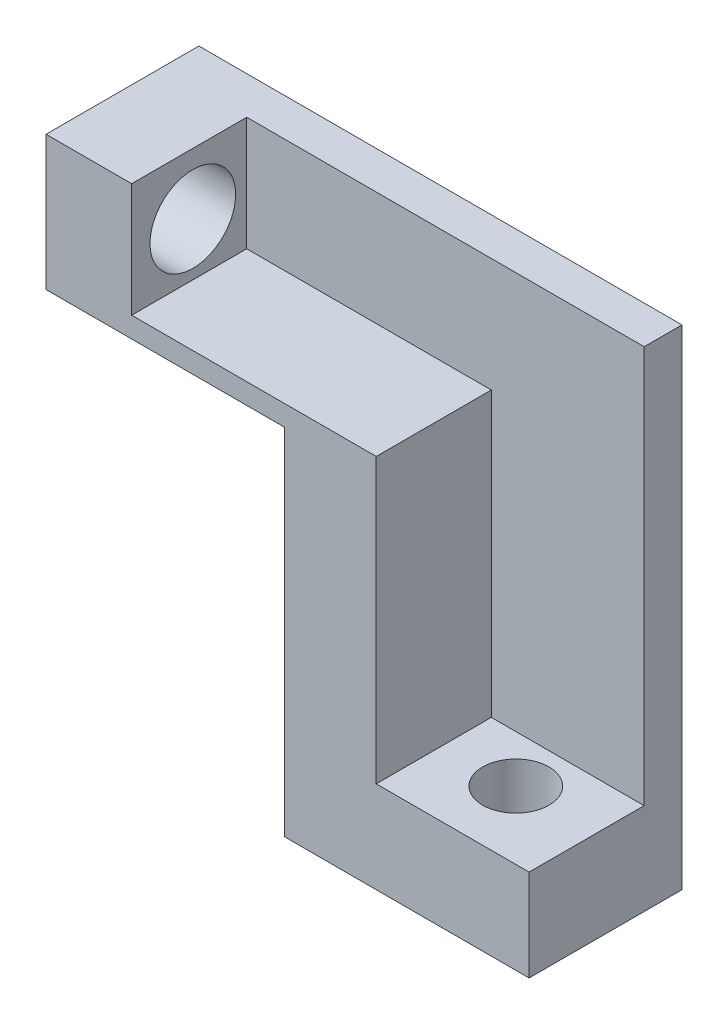
from build123d import *

# Parameters (mm, degrees)
BOSS_EXTRUDE1_DEPTH     = 25
SKETCH2_R               = 5.423503102
CUT_EXTRUDE1_DEPTH      = 30
CUT_EXTRUDE2_DEPTH      = 100
CUT_EXTRUDE2_DEPTH_BACK = 100
SKETCH3_R               = 7
SKETCH5_W               = 24.154567728
SKETCH5_H               = 18.630175127
CUT_EXTRUDE3_DEPTH      = 40
SKETCH6_W               = 6.182333227
SKETCH6_H               = 65
BOSS_EXTRUDE2_DEPTH     = 25


with BuildPart() as part:
    # Sketch1 → Boss-Extrude1 (new body)
    with BuildSketch(Plane.XY):
        Polygon((40, -23.325428286), (0, -23.325428286), (0, 34.674571714), (-39.002820891, 34.674571714), (-39.002820891, 56.674571714), (15, 56.674571714), (15, -8.325428286), (40, -8.325428286), align=None)
    extrude(amount=BOSS_EXTRUDE1_DEPTH)

    # Sketch2 → Cut-Extrude1 (cut)
    with BuildSketch(Plane(origin=(0, -8.325428286, 0), x_dir=(1, 0, 0), z_dir=(0, 1, 0))):
        with Locations((26.730150284, -13.901343103)):
            Circle(SKETCH2_R)
    extrude(amount=-CUT_EXTRUDE1_DEPTH, mode=Mode.SUBTRACT)

    # Sketch3 → Cut-Extrude2 (cut, two sides: drawn at the far end of the back side and taken through both)
    with BuildSketch(Plane(origin=(12.442617708, 0, 0), x_dir=(0, 0, -1), z_dir=(1, 0, 0)).offset(-CUT_EXTRUDE2_DEPTH_BACK)):
        with Locations((-15, 46.674571714)):
            Circle(SKETCH3_R)
    extrude(amount=CUT_EXTRUDE2_DEPTH + CUT_EXTRUDE2_DEPTH_BACK, mode=Mode.SUBTRACT)

    # Sketch5 → Cut-Extrude3 (cut)
    with BuildSketch(Plane(origin=(15, 0, 0), x_dir=(0, 0, -1), z_dir=(1, 0, 0))):
        with Locations((-18.259617091, 47.359484151)):
            Rectangle(SKETCH5_W, SKETCH5_H)
    extrude(amount=-CUT_EXTRUDE3_DEPTH, mode=Mode.SUBTRACT)

    # Sketch6 → Boss-Extrude2 (add)
    with BuildSketch(Plane(origin=(15, 0, 0), x_dir=(0, 0, -1), z_dir=(1, 0, 0))):
        with Locations((-3.091166613, 24.174571714)):
            Rectangle(SKETCH6_W, SKETCH6_H)
    extrude(amount=BOSS_EXTRUDE2_DEPTH)


solid = part.part
